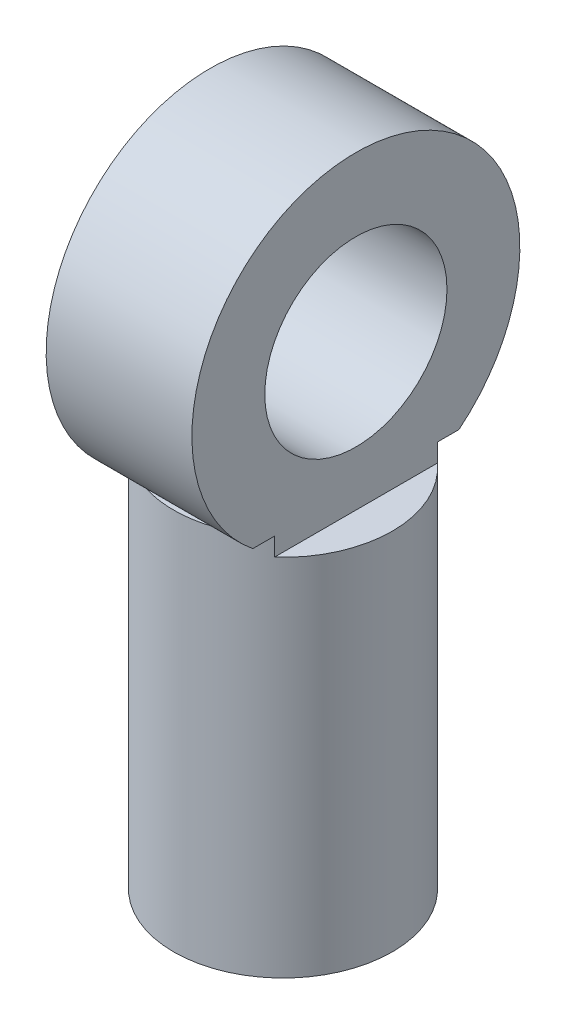
from build123d import *

# Parameters (mm, degrees)
SKETCH1_R                = 3
BOSS_EXTRUDE1_DEPTH      = 10
SKETCH2_R                = 1.55
CUT_EXTRUDE1_DEPTH       = 9
BOSS_EXTRUDE2_DEPTH      = 2
BOSS_EXTRUDE2_DEPTH_BACK = 2
SKETCH4_R                = 2.5
CUT_EXTRUDE2_DEPTH       = 20.685019685
SKETCH1_2_OUTSIDE_W      = 12.286
SKETCH1_2_OUTSIDE_H      = 15.286
SKETCH1_2_OUTSIDE_R      = 3
CUT_EXTRUDE3_DEPTH       = 10.5


with BuildPart() as part:
    # Sketch1 → Boss-Extrude1 (new body)
    with BuildSketch(Plane(origin=(0, 0, 0), x_dir=(1, 0, 0), z_dir=(0, 1, 0))):
        Circle(SKETCH1_R)
    extrude(amount=BOSS_EXTRUDE1_DEPTH)

    # Sketch2 → Cut-Extrude1 (cut)
    with BuildSketch(Plane.XZ):
        Circle(SKETCH2_R)
    extrude(amount=-CUT_EXTRUDE1_DEPTH, mode=Mode.SUBTRACT)

    # Sketch3 → Boss-Extrude2 (add, two sides: drawn at the far end of the back side and taken through both)
    with BuildSketch(Plane(origin=(0, 0, 0), x_dir=(0, 0, -1), z_dir=(1, 0, 0)).offset(-BOSS_EXTRUDE2_DEPTH_BACK)):
        with BuildLine():
            Line((-3, 10.5), (-3, 10))
            Line((-3, 10), (3, 10))
            Line((3, 10), (3, 10.5))
            Line((3, 10.5), (2.828427125, 10.5))
            ThreePointArc((2.828427125, 10.5), (0, 18.5), (-2.828427125, 10.5))
            Line((-2.828427125, 10.5), (-3, 10.5))
        make_face()
    extrude(amount=BOSS_EXTRUDE2_DEPTH + BOSS_EXTRUDE2_DEPTH_BACK)

    # Sketch4 → Cut-Extrude2 (cut, through all)
    with BuildSketch(Plane(origin=(2, 0, 0), x_dir=(0, 0, -1), z_dir=(1, 0, 0))):
        with Locations((0, 14)):
            Circle(SKETCH4_R)
    extrude(amount=-CUT_EXTRUDE2_DEPTH, mode=Mode.SUBTRACT)

    # Sketch1<2> outside → Cut-Extrude3 (cut)
    with BuildSketch(Plane(origin=(0, 0, 0), x_dir=(1, 0, 0), z_dir=(0, 1, 0))):
        Rectangle(SKETCH1_2_OUTSIDE_W, SKETCH1_2_OUTSIDE_H)
        Circle(SKETCH1_2_OUTSIDE_R, mode=Mode.SUBTRACT)
    extrude(amount=CUT_EXTRUDE3_DEPTH, mode=Mode.SUBTRACT)


solid = part.part
